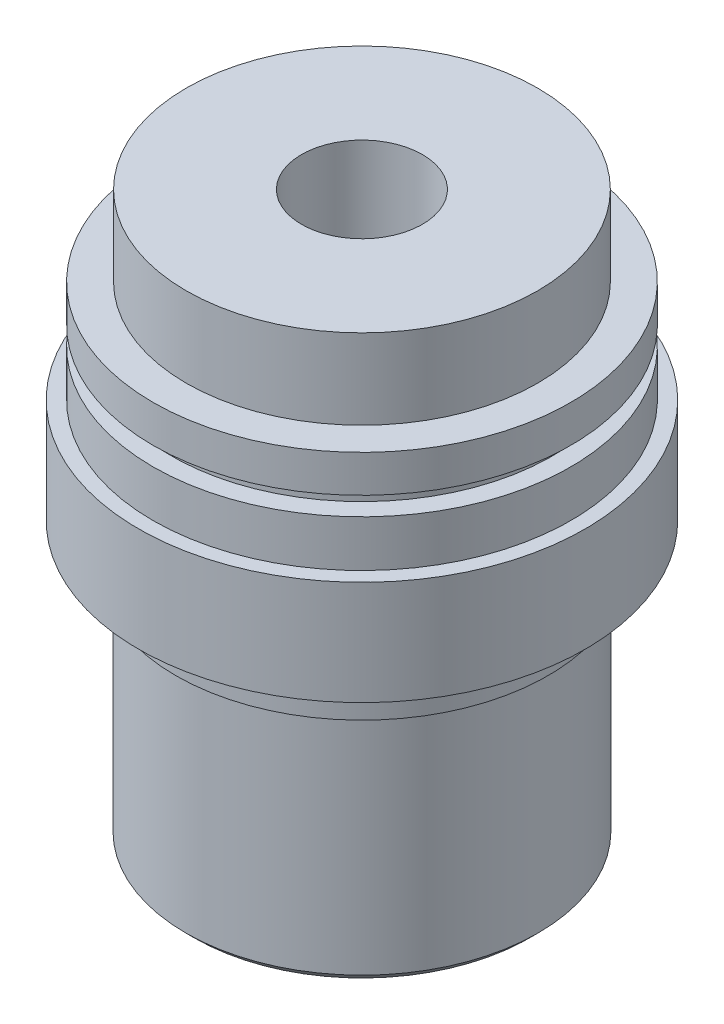
from build123d import *

# Parameters (mm, degrees)
CHAMFER1_SIZE = 0.45


with BuildPart() as part:
    # Sketch1 → Revolve1 (revolve)
    with BuildSketch(Plane.XY):
        Polygon((3.25, 0), (3.25, 30.33), (9.44, 30.33), (9.44, 26.03), (11.225, 26.03), (11.225, 24.03), (10.225, 24.03), (10.225, 23.03), (11.225, 23.03), (11.225, 20.53), (12, 20.53), (12, 14.93), (10, 14.93), (10, 12.7), (9.46, 12.7), (9.46, 0), align=None)
    revolve(axis=Axis((0, 0, 0), (0, 1, 0)))

    # Chamfer1
    chamfer1_edges = [part.edges().sort_by_distance(p)[0] for p in [
        (-10, 14.93, 0),
        (-9.46, 0, 0),
        (-3.25, 0, 0),
    ]]
    chamfer(chamfer1_edges, length=CHAMFER1_SIZE)


solid = part.part
